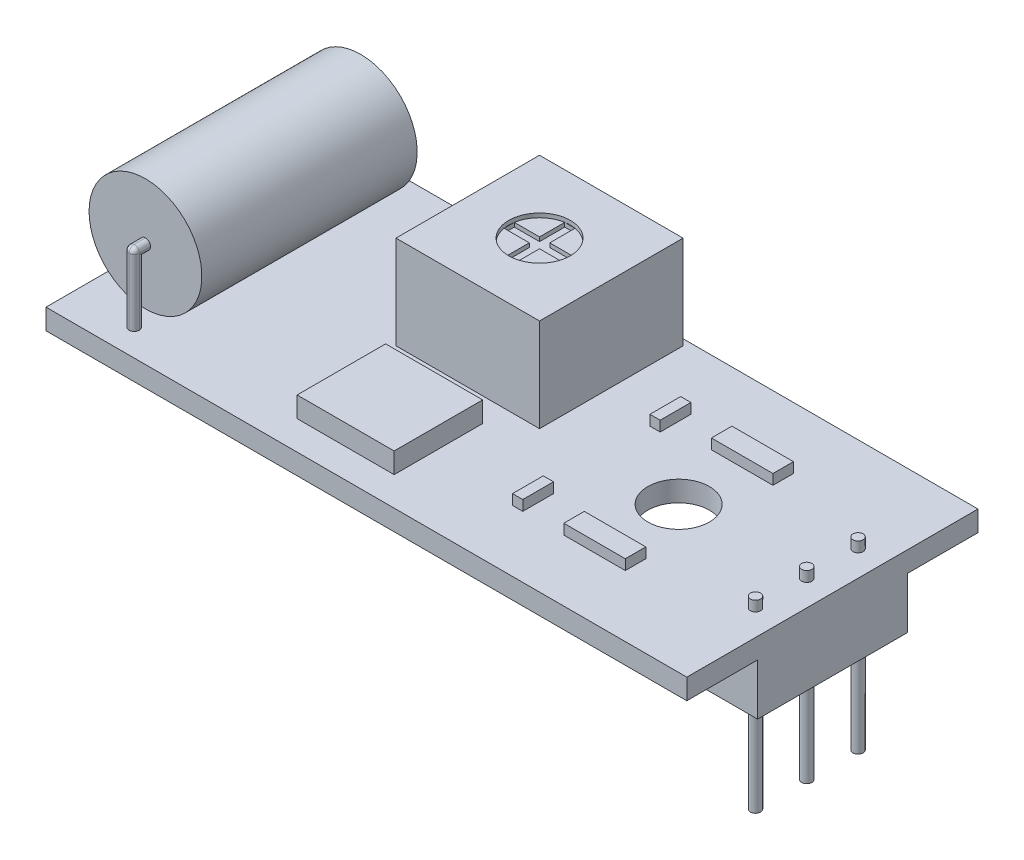
from build123d import *

# Parameters (mm, degrees)
ESQUISSE1_W              = 31.25
ESQUISSE1_H              = 14.2
BOSS_EXTRU_1_DEPTH       = 1
ESQUISSE2_W              = 0.5
ESQUISSE2_H              = 0.5
BOSS_EXTRU_2_DEPTH       = 3.5
ESQUISSE3_W              = 0.5
ESQUISSE3_H              = 0.5
BOSS_EXTRU_3_DEPTH       = 0.3
ESQUISSE4_W              = 0.5
ESQUISSE4_H              = 0.5
BOSS_EXTRU_4_DEPTH       = 0.3
ESQUISSE5_R              = 2.75
BOSS_EXTRU_5_DEPTH       = 10.5
ESQUISSE6_W              = 7
ESQUISSE6_H              = 7
BOSS_EXTRU_6_DEPTH       = 4.55
ESQUISSE7_R              = 1.5
ENL_V_MAT_EXTRU_1_DEPTH  = 0.2
ESQUISSE8_W              = 1.229019946
ESQUISSE8_H              = 0.5
ESQUISSE8_W_2            = 0.5
ESQUISSE8_H_2            = 1.229019946
ENL_V_MAT_EXTRU_2_DEPTH  = 0.2
ESQUISSE9_W              = 4.73100796
ESQUISSE9_H              = 4.316007262
ESQUISSE9_W_2            = 3
ESQUISSE9_H_2            = 1
ESQUISSE9_W_3            = 0.5
ESQUISSE9_H_3            = 1.5
BOSS_EXTRU_7_DEPTH       = 0.5
ESQUISSE10_W             = 4.73100796
ESQUISSE10_H             = 4.316007262
BOSS_EXTRU_8_DEPTH       = 0.5
ESQUISSE11_R             = 1.5
ENL_V_MAT_EXTRU_3_DEPTH  = 22.5
ESQUISSE12_W             = 2.5
ESQUISSE12_H             = 7.3
BOSS_EXTRU_9_DEPTH       = 2.5
BOSS_EXTRU_10_DEPTH      = 5
BOSS_EXTRU_10_DEPTH_BACK = 4
ESQUISSE13_R             = 0.25
CONG_1_R                 = 0.25
CONG_2_R                 = 0.25
CONG_3_R                 = 0.25


with BuildPart() as part:
    # Esquisse1 → Boss.-Extru.1 (new body)
    with BuildSketch(Plane(origin=(0, 0, 0), x_dir=(1, 0, 0), z_dir=(0, 1, 0))):
        with Locations((-15.625, 7.1)):
            Rectangle(ESQUISSE1_W, ESQUISSE1_H)
    extrude(amount=BOSS_EXTRU_1_DEPTH)

    # Esquisse2 → Boss.-Extru.2 (add)
    with BuildSketch(Plane(origin=(0, 1, 0), x_dir=(1, 0, 0), z_dir=(0, 1, 0))):
        with Locations((-28.25, 12.9)):
            Rectangle(ESQUISSE2_W, ESQUISSE2_H)
        with Locations((-28.25, 1.3)):
            Rectangle(ESQUISSE2_W, ESQUISSE2_H)
    extrude(amount=BOSS_EXTRU_2_DEPTH)

    # Esquisse3 → Boss.-Extru.3 (add)
    with BuildSketch(Plane.XY.offset(-12.65)):
        with Locations((-28.25, 4.25)):
            Rectangle(ESQUISSE3_W, ESQUISSE3_H)
    extrude(amount=BOSS_EXTRU_3_DEPTH)

    # Esquisse4 → Boss.-Extru.4 (add)
    with BuildSketch(Plane(origin=(0, 0, -1.55), x_dir=(-1, 0, 0), z_dir=(0, 0, -1))):
        with Locations((28.25, 4.25)):
            Rectangle(ESQUISSE4_W, ESQUISSE4_H)
    extrude(amount=BOSS_EXTRU_4_DEPTH)

    # Esquisse5 → Boss.-Extru.5 (add)
    with BuildSketch(Plane.XY.offset(-12.35)):
        with Locations(Location((-28.25, 4.25, 0), (0, 0, 180))):
            Circle(ESQUISSE5_R)
    extrude(amount=BOSS_EXTRU_5_DEPTH)

    # Esquisse6 → Boss.-Extru.6 (add)
    with BuildSketch(Plane(origin=(0, 1, 0), x_dir=(1, 0, 0), z_dir=(0, 1, 0))):
        with Locations((-17.582259182, 10.4)):
            Rectangle(ESQUISSE6_W, ESQUISSE6_H)
    extrude(amount=BOSS_EXTRU_6_DEPTH)

    # Esquisse7 → Enlèv. mat.-Extru.1 (cut)
    with BuildSketch(Plane(origin=(0, 5.55, 0), x_dir=(1, 0, 0), z_dir=(0, 1, 0))):
        with Locations(Location((-17.582259182, 10.4, 0), (0, 0, 270))):
            Circle(ESQUISSE7_R)
    extrude(amount=-ENL_V_MAT_EXTRU_1_DEPTH, mode=Mode.SUBTRACT)

    # Esquisse8 → Enlèv. mat.-Extru.2 (cut)
    with BuildSketch(Plane(origin=(0, 5.35, 0), x_dir=(1, 0, 0), z_dir=(0, 1, 0))):
        with Locations((-18.446769155, 10.4)):
            Rectangle(ESQUISSE8_W, ESQUISSE8_H)
        with Locations((-17.582259182, 9.535490027)):
            Rectangle(ESQUISSE8_W_2, ESQUISSE8_H_2)
        with Locations((-16.717749209, 10.4)):
            Rectangle(ESQUISSE8_W, ESQUISSE8_H)
        with Locations((-17.582259182, 11.264509973)):
            Rectangle(ESQUISSE8_W_2, ESQUISSE8_H_2)
        with Locations((-17.582259182, 10.4)):
            Rectangle(ESQUISSE8_W_2, ESQUISSE8_H)
    extrude(amount=-ENL_V_MAT_EXTRU_2_DEPTH, mode=Mode.SUBTRACT)

    # Esquisse9 → Boss.-Extru.7 (add)
    with BuildSketch(Plane(origin=(0, 1, 0), x_dir=(1, 0, 0), z_dir=(0, 1, 0))):
        with Locations((-18.052754085, 3.572494065)):
            Rectangle(ESQUISSE9_W, ESQUISSE9_H)
        with Locations((-7.5, 3.5)):
            Rectangle(ESQUISSE9_W_2, ESQUISSE9_H_2)
        with Locations((-7.5, 10.7)):
            Rectangle(ESQUISSE9_W_2, ESQUISSE9_H_2)
        with Locations((-11.25, 3.75)):
            Rectangle(ESQUISSE9_W_3, ESQUISSE9_H_3)
        with Locations((-11.25, 10.45)):
            Rectangle(ESQUISSE9_W_3, ESQUISSE9_H_3)
    extrude(amount=BOSS_EXTRU_7_DEPTH)

    # Esquisse10 → Boss.-Extru.8 (add)
    with BuildSketch(Plane(origin=(0, 1.5, 0), x_dir=(1, 0, 0), z_dir=(0, 1, 0))):
        with Locations((-18.052754085, 3.572494065)):
            Rectangle(ESQUISSE10_W, ESQUISSE10_H)
    extrude(amount=BOSS_EXTRU_8_DEPTH)

    # Esquisse11 → Enlèv. mat.-Extru.3 (cut)
    with BuildSketch(Plane(origin=(0, 1, 0), x_dir=(1, 0, 0), z_dir=(0, 1, 0))):
        with Locations(Location((-7.5, 7.1, 0), (0, 0, 270))):
            Circle(ESQUISSE11_R)
    extrude(amount=-ENL_V_MAT_EXTRU_3_DEPTH, mode=Mode.SUBTRACT)

    # Esquisse12 → Boss.-Extru.9 (add)
    with BuildSketch(Plane(origin=(0, 0, 0), x_dir=(-1, 0, 0), z_dir=(0, -1, 0))):
        with Locations((1.25, 7.1)):
            Rectangle(ESQUISSE12_W, ESQUISSE12_H)
    extrude(amount=BOSS_EXTRU_9_DEPTH)

    # Esquisse13 → Boss.-Extru.10 (add, two sides: drawn at the far end of the back side and taken through both)
    with BuildSketch(Plane(origin=(0, -2.5, 0), x_dir=(-1, 0, 0), z_dir=(0, -1, 0)).offset(-BOSS_EXTRU_10_DEPTH_BACK)):
        with Locations(Location((1.25, 9.6, 0), (0, 0, 90))):
            Circle(ESQUISSE13_R)
        with Locations(Location((1.25, 7.1, 0), (0, 0, 90))):
            Circle(ESQUISSE13_R)
        with Locations(Location((1.25, 4.6, 0), (0, 0, 90))):
            Circle(ESQUISSE13_R)
    extrude(amount=BOSS_EXTRU_10_DEPTH + BOSS_EXTRU_10_DEPTH_BACK)

    # Congé1
    cong_1_edges = [part.edges().sort_by_distance(p)[0] for p in [
        (-28.5, 2.5, -1.55),
        (-28, 2.75, -1.05),
        (-28, 2.5, -1.55),
        (-28.5, 2.75, -1.05),
    ]]
    fillet(cong_1_edges, radius=CONG_1_R - 0.0001)  # a hair under: the kernel refuses the full size

    # Congé2
    cong_2_edges = [part.edges().sort_by_distance(p)[0] for p in [
        (-28.5, 4, -1.57505),
        (-28, 4, -1.57505),
        (-28.426805985, 4.5, -1.123194015),
        (-28.073194015, 4.5, -1.123194015),
        (-28.5, 4.5, -1.57495),
        (-28, 4.5, -1.57495),
    ]]
    fillet(cong_2_edges, radius=CONG_2_R - 0.0001)  # a hair under: the kernel refuses the full size

    # Congé3
    cong_3_edges = [part.edges().sort_by_distance(p)[0] for p in [
        (-28, 4, -12.5),
        (-28, 2.5, -12.65),
        (-28, 2.75, -13.15),
        (-28, 4.5, -12.75),
        (-28.5, 2.5, -12.65),
        (-28.5, 4, -12.5),
        (-28.5, 4.5, -12.75),
        (-28.5, 2.75, -13.15),
    ]]
    fillet(cong_3_edges, radius=CONG_3_R - 0.0001)  # a hair under: the kernel refuses the full size


solid = part.part
